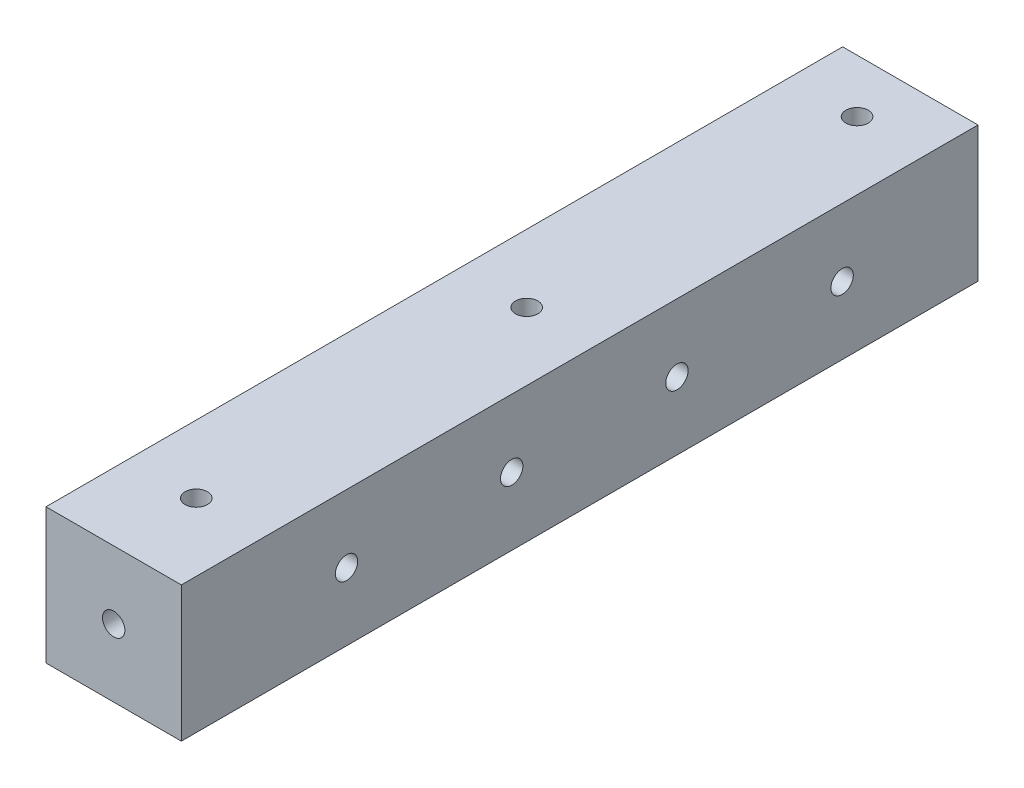
from build123d import *

# Parameters (mm, degrees)
SKETCH1_W                 = 25.4
SKETCH1_H                 = 25.4
BOSS_EXTRUDE1_DEPTH       = 77.5
M5X0_8_TAPPED_HOLE3_D     = 4.2
M5X0_8_TAPPED_HOLE2_D     = 4.2
M5X0_8_TAPPED_HOLE1_D     = 4.2
M5X0_8_TAPPED_HOLE1_DEPTH = 10
M5X0_8_TAPPED_HOLE1_TIP   = 1.2618073
SKETCH13_W                = 25.4
SKETCH13_H                = 5.5
CUT_EXTRUDE1_DEPTH        = 83.539081652


with BuildPart() as part:
    # Sketch1 → Boss-Extrude1 (new, symmetric)
    with BuildSketch(Plane.XY):
        Rectangle(SKETCH1_W, SKETCH1_H)
    extrude(amount=BOSS_EXTRUDE1_DEPTH, both=True)

    # M5x0.8 Tapped Hole3 (through all)
    with Locations(Plane(origin=(12.7, 0, 0), x_dir=(0, 0, -1), z_dir=(1, 0, 0))):
        with Locations((-46.5, 0), (-15.5, 0), (15.5, 0), (46.5, 0)):
            Hole(M5X0_8_TAPPED_HOLE3_D / 2)

    # M5x0.8 Tapped Hole2 (through all)
    with Locations(Plane(origin=(0, -12.7, 0), x_dir=(-1, 0, 0), z_dir=(0, -1, 0))):
        with Locations((0, -62), (0, 0), (0, 62)):
            Hole(M5X0_8_TAPPED_HOLE2_D / 2)

    # M5x0.8 Tapped Hole1
    with Locations(Plane.XY.offset(77.5)):
        with Locations((0, 0)):
            Hole(M5X0_8_TAPPED_HOLE1_D / 2, depth=M5X0_8_TAPPED_HOLE1_DEPTH)
            with Locations((0, 0, -(M5X0_8_TAPPED_HOLE1_DEPTH + M5X0_8_TAPPED_HOLE1_TIP / 2))):  # 118° drill point
                Cone(0, M5X0_8_TAPPED_HOLE1_D / 2, M5X0_8_TAPPED_HOLE1_TIP, mode=Mode.SUBTRACT)

    # Sketch13 → Cut-Extrude1 (cut, through all)
    with BuildSketch(Plane(origin=(0, 12.7, 0), x_dir=(1, 0, 0), z_dir=(0, 1, 0))):
        with Locations((0, 74.75)):
            Rectangle(SKETCH13_W, SKETCH13_H)
    extrude(amount=-CUT_EXTRUDE1_DEPTH, mode=Mode.SUBTRACT)


solid = part.part
